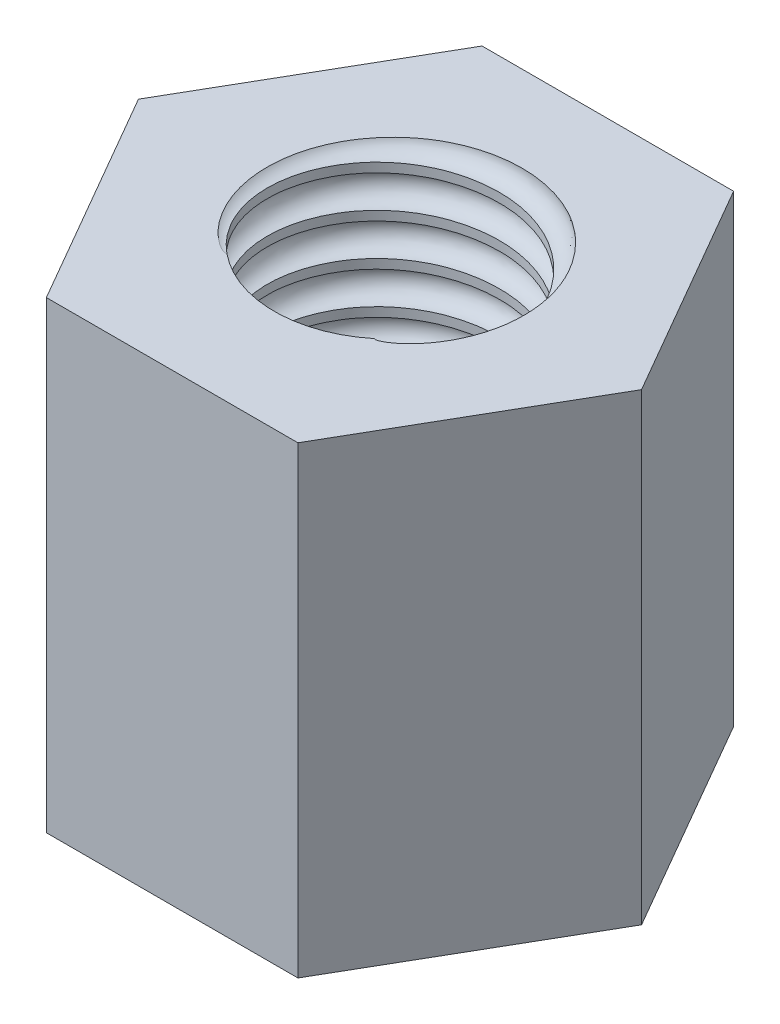
from build123d import *

# Parameters (mm, degrees)
BOSS_EXTRUDE1_DEPTH = 5
SKETCH2_R           = 1.25
BOSS_EXTRUDE2_DEPTH = 6
CUT_SWEEP3_PITCH    = 0.45
SKETCH9_R           = 1.25
CUT_EXTRUDE1_DEPTH  = 6
CUT_SWEEP4_PITCH    = 0.45
CUT_SWEEP4_TO       = 5


with BuildPart() as part:
    # Sketch1 → Boss-Extrude1 (new body)
    with BuildSketch(Plane(origin=(0, 0, 0), x_dir=(1, 0, 0), z_dir=(0, 1, 0))):
        Polygon((1.356773133, -2.35), (2.713546265, 0), (1.356773133, 2.35), (-1.356773133, 2.35), (-2.713546265, 0), (-1.356773133, -2.35), align=None)
    extrude(amount=BOSS_EXTRUDE1_DEPTH)

    # Sketch2 → Boss-Extrude2 (add)
    with BuildSketch(Plane.XZ):
        with Locations(Location((0, 0, 0), (0, 0, 270))):
            Circle(SKETCH2_R)
    extrude(amount=BOSS_EXTRUDE2_DEPTH)

    # Cut-Sweep3: arcs per turn and ends read off the stored shape
    # Cut-Sweep3: the profile of Sketch5 screwed along a right-hand helix through 14.25 turns, 6 arcs to a turn; built about Z, then put on its axis
    cut_sweep3_z = Axis((0, 0, 0), (0, 0, 1))
    cut_sweep3_corners = [(1.1, 0, -0.45), (1.25, 0, -0.3), (1.4, 0, -0.45), (1.25, 0, -0.6)]
    with BuildLine(mode=Mode.PRIVATE) as cut_sweep3_profile:
        ThreePointArc((1.1, 0, -0.45), (1.143933983, 0, -0.343933983), (1.25, 0, -0.3))
        ThreePointArc((1.25, 0, -0.3), (1.356066017, 0, -0.343933983), (1.4, 0, -0.45))
        ThreePointArc((1.4, 0, -0.45), (1.356066017, 0, -0.556066017), (1.25, 0, -0.6))
        ThreePointArc((1.25, 0, -0.6), (1.143933983, 0, -0.556066017), (1.1, 0, -0.45))
    cut_sweep3_cap = Face(cut_sweep3_profile.wire())
    cut_sweep3_arcs = [((1.1, 0, -0.45), (1.1, 0, -0.3), (1.25, 0, -0.3), (1, 0.7071067811865476, 1)), ((1.25, 0, -0.3), (1.4, 0, -0.3), (1.4, 0, -0.45), (1, 0.7071067811865476, 1)), ((1.4, 0, -0.45), (1.4, 0, -0.6), (1.25, 0, -0.6), (1, 0.7071067811865476, 1)), ((1.25, 0, -0.6), (1.1, 0, -0.6), (1.1, 0, -0.45), (1, 0.7071067811865476, 1))]  # start, shoulder, end, weights
    cut_sweep3_turn_angles = [0, 30, 60, 90, 120, 150, 180, 210, 240, 270, 300, 330, 360]
    cut_sweep3_turn_weights = [1, 0.8660254037844387, 1, 0.8660254037844387, 1, 0.8660254037844387, 1, 0.8660254037844387, 1, 0.8660254037844387, 1, 0.8660254037844387, 1]
    cut_sweep3_turn_sides = [Face.make_bezier_surface([[Vector(p[j][0], p[j][1], 0).rotate(cut_sweep3_z, cut_sweep3_turn_angles[2 * i + k]) / cut_sweep3_turn_weights[2 * i + k] + Vector(0, 0, p[j][2] + CUT_SWEEP3_PITCH * cut_sweep3_turn_angles[2 * i + k] / 360) for k in range(3)] for j in range(3)], [[p[3][j] * cut_sweep3_turn_weights[2 * i + k] for k in range(3)] for j in range(3)]) for p in cut_sweep3_arcs for i in range(6)]
    cut_sweep3_last_angles = [5040, 5070, 5100, 5115, 5130]
    cut_sweep3_last_weights = [1, 0.8660254037844387, 1, 0.9659258262890683, 1]
    cut_sweep3_last_sides = [Face.make_bezier_surface([[Vector(p[j][0], p[j][1], 0).rotate(cut_sweep3_z, cut_sweep3_last_angles[2 * i + k]) / cut_sweep3_last_weights[2 * i + k] + Vector(0, 0, p[j][2] + CUT_SWEEP3_PITCH * cut_sweep3_last_angles[2 * i + k] / 360) for k in range(3)] for j in range(3)], [[p[3][j] * cut_sweep3_last_weights[2 * i + k] for k in range(3)] for j in range(3)]) for p in cut_sweep3_arcs for i in range(2)]
    cut_sweep3 = Plane(origin=(0, -6, 0), x_dir=(0, 0, 1), z_dir=(0, 1, 0)) * Solid(Shell([*[p.moved(Location((0, 0, CUT_SWEEP3_PITCH * i))) for i in range(14) for p in cut_sweep3_turn_sides], *cut_sweep3_last_sides, cut_sweep3_cap, cut_sweep3_cap.rotate(cut_sweep3_z, 5130).moved(Location((0, 0, CUT_SWEEP3_PITCH * 5130 / 360)))]))
    add(cut_sweep3, mode=Mode.SUBTRACT)

    # Sketch9 → Cut-Extrude1 (cut)
    with BuildSketch(Plane(origin=(0, 5, 0), x_dir=(1, 0, 0), z_dir=(0, 1, 0))):
        with Locations(Location((0, 0, 0), (0, 0, 270))):
            Circle(SKETCH9_R)
    extrude(amount=-CUT_EXTRUDE1_DEPTH, mode=Mode.SUBTRACT)


with BuildPart() as cut_extrude1_piece_1:
    # of the separate pieces the step leaves, piece 1, a body of its own (cut_extrude1_pieces)
    add(part.part.solids().sort_by_distance((1.356773133, 0, 2.35))[0])

    # Cut-Sweep4: arcs per turn and ends read off the stored shape
    # Cut-Sweep4: the profile of Sketch11 screwed along a right-hand helix through 14.25 turns, 6 arcs to a turn; built about Z, then put on its axis
    cut_sweep4_z = Axis((0, 0, 0), (0, 0, 1))
    cut_sweep4_corners = [(1.425, 0, -0.45), (1.25, 0, -0.625), (1.075, 0, -0.45), (1.25, 0, -0.275)]
    with BuildLine(mode=Mode.PRIVATE) as cut_sweep4_profile:
        ThreePointArc((1.425, 0, -0.45), (1.373743687, 0, -0.573743687), (1.25, 0, -0.625))
        ThreePointArc((1.25, 0, -0.625), (1.126256313, 0, -0.573743687), (1.075, 0, -0.45))
        ThreePointArc((1.075, 0, -0.45), (1.126256313, 0, -0.326256313), (1.25, 0, -0.275))
        ThreePointArc((1.25, 0, -0.275), (1.373743687, 0, -0.326256313), (1.425, 0, -0.45))
    cut_sweep4_cap = Face(cut_sweep4_profile.wire())
    cut_sweep4_arcs = [((1.425, 0, -0.45), (1.425, 0, -0.625), (1.25, 0, -0.625), (1, 0.7071067811865476, 1)), ((1.25, 0, -0.625), (1.075, 0, -0.625), (1.075, 0, -0.45), (1, 0.7071067811865476, 1)), ((1.075, 0, -0.45), (1.075, 0, -0.275), (1.25, 0, -0.275), (1, 0.7071067811865476, 1)), ((1.25, 0, -0.275), (1.425, 0, -0.275), (1.425, 0, -0.45), (1, 0.7071067811865476, 1))]  # start, shoulder, end, weights
    cut_sweep4_turn_angles = [0, 30, 60, 90, 120, 150, 180, 210, 240, 270, 300, 330, 360]
    cut_sweep4_turn_weights = [1, 0.8660254037844387, 1, 0.8660254037844387, 1, 0.8660254037844387, 1, 0.8660254037844387, 1, 0.8660254037844387, 1, 0.8660254037844387, 1]
    cut_sweep4_turn_sides = [Face.make_bezier_surface([[Vector(p[j][0], p[j][1], 0).rotate(cut_sweep4_z, cut_sweep4_turn_angles[2 * i + k]) / cut_sweep4_turn_weights[2 * i + k] + Vector(0, 0, p[j][2] + CUT_SWEEP4_PITCH * cut_sweep4_turn_angles[2 * i + k] / 360) for k in range(3)] for j in range(3)], [[p[3][j] * cut_sweep4_turn_weights[2 * i + k] for k in range(3)] for j in range(3)]) for p in cut_sweep4_arcs for i in range(6)]
    cut_sweep4_last_angles = [5040, 5070, 5100, 5115, 5130]
    cut_sweep4_last_weights = [1, 0.8660254037844387, 1, 0.9659258262890683, 1]
    cut_sweep4_last_sides = [Face.make_bezier_surface([[Vector(p[j][0], p[j][1], 0).rotate(cut_sweep4_z, cut_sweep4_last_angles[2 * i + k]) / cut_sweep4_last_weights[2 * i + k] + Vector(0, 0, p[j][2] + CUT_SWEEP4_PITCH * cut_sweep4_last_angles[2 * i + k] / 360) for k in range(3)] for j in range(3)], [[p[3][j] * cut_sweep4_last_weights[2 * i + k] for k in range(3)] for j in range(3)]) for p in cut_sweep4_arcs for i in range(2)]
    cut_sweep4 = Plane(origin=(0, 5, 0), x_dir=(0, 0, -1), z_dir=(0, -1, 0)) * split(Solid(Shell([*[p.moved(Location((0, 0, CUT_SWEEP4_PITCH * i))) for i in range(14) for p in cut_sweep4_turn_sides], *cut_sweep4_last_sides, cut_sweep4_cap, cut_sweep4_cap.rotate(cut_sweep4_z, 5130).moved(Location((0, 0, CUT_SWEEP4_PITCH * 5130 / 360)))])), bisect_by=Plane.XY.offset(CUT_SWEEP4_TO), keep=Keep.BOTTOM, mode=Mode.PRIVATE)
    add(cut_sweep4, mode=Mode.SUBTRACT)


with BuildPart() as cut_extrude1_piece_2:
    # of the separate pieces the step leaves, piece 2, a body of its own (cut_extrude1_pieces)
    add(part.part.solids().sort_by_distance((0, -1.125, -1.25))[0])


solid = cut_extrude1_piece_1.part
